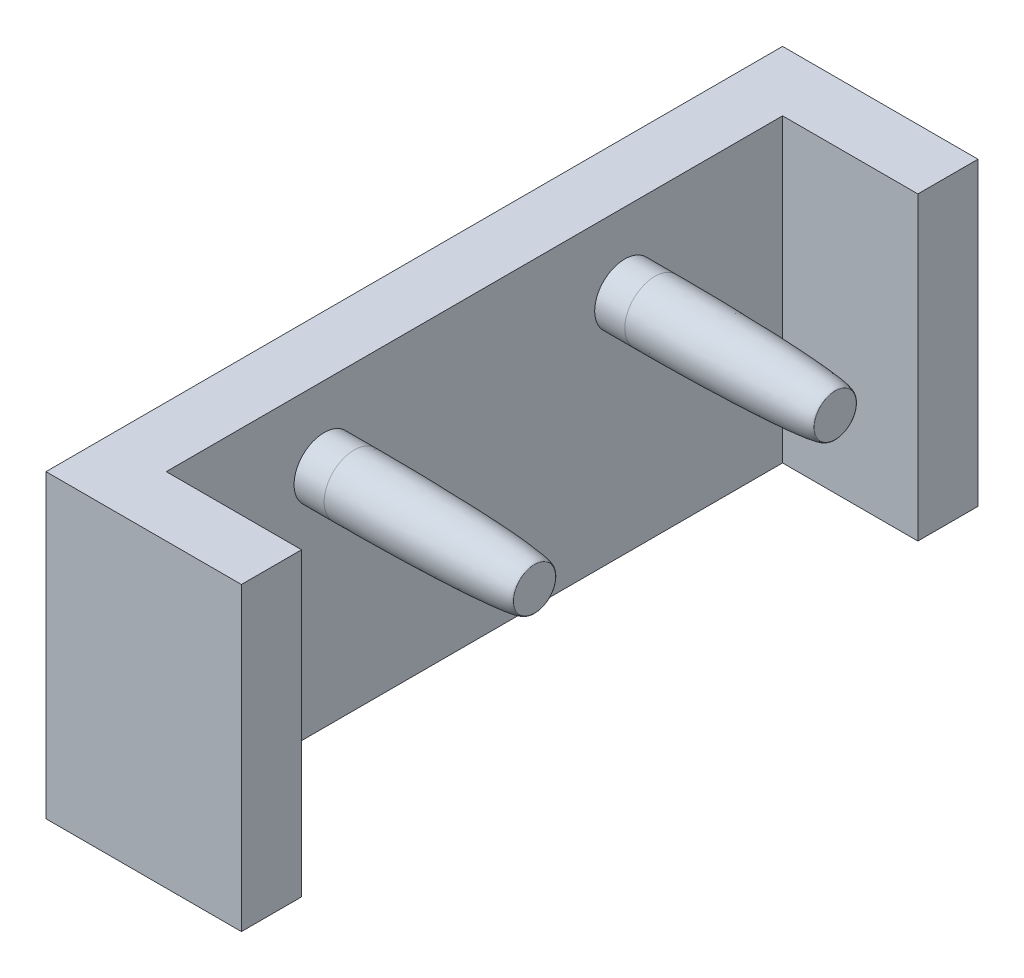
from build123d import *

# Parameters (mm, degrees)
SKETCH1_R             = 1
BOSS_EXTRUDE1_DEPTH   = 7
BOSS_EXTRUDE1_2_DEPTH = 7
SKETCH2_W             = 20.5
SKETCH2_H             = 10
BOSS_EXTRUDE2_DEPTH   = 2
SKETCH4_W             = 2
SKETCH4_H             = 10
BOSS_EXTRUDE3_DEPTH   = 6.5
FILLET1_SIZE          = 6
FILLET1_SIZE_2        = 0.3


with BuildPart() as part:
    # Sketch1 → Boss-Extrude1 (new body)
    with BuildSketch(Plane(origin=(0, 0, 0), x_dir=(0, 0, -1), z_dir=(1, 0, 0))):
        with Locations((-5, 0)):
            Circle(SKETCH1_R)
    extrude(amount=BOSS_EXTRUDE1_DEPTH)



with BuildPart() as body_2:
    # Sketch1 → Boss-Extrude1 2 (new body)
    with BuildSketch(Plane(origin=(0, 0, 0), x_dir=(0, 0, -1), z_dir=(1, 0, 0))):
        with Locations((5, 0)):
            Circle(SKETCH1_R)
    extrude(amount=BOSS_EXTRUDE1_2_DEPTH)


with BuildPart() as part_1:
    add(part.part)

    add(body_2.part)  # Boss-Extrude2 merges body 2
    # Sketch2 → Boss-Extrude2 (add)
    with BuildSketch(Plane.ZY):
        with Locations((0, -2.5)):
            Rectangle(SKETCH2_W, SKETCH2_H)
    extrude(amount=BOSS_EXTRUDE2_DEPTH)

    # Sketch4 → Boss-Extrude3 (add)
    with BuildSketch(Plane.ZY.offset(2)):
        with Locations((-11.25, -2.5)):
            Rectangle(SKETCH4_W, SKETCH4_H)
        with Locations((11.25, -2.5)):
            Rectangle(SKETCH4_W, SKETCH4_H)
    extrude(amount=-BOSS_EXTRUDE3_DEPTH)

    # Fillet1
    # an asymmetric fillet: 6, 0.3 mm, written as the material it takes off along each edge
    with BuildSketch(Plane(origin=(7, 0, -5), x_dir=(0, 0, -1), z_dir=(0, -1, 0))) as fillet1_piece_1:
        with BuildLine():
            Bezier((1, -FILLET1_SIZE), (1, 0), (1 - FILLET1_SIZE_2, 0), weights=[1, 0.707106781, 1])
            Line((1 - FILLET1_SIZE_2, 0), (1, 0))
            Line((1, 0), (1, -FILLET1_SIZE))
        make_face()
    revolve(axis=Axis((7, 0, -5), (1, 0, 0)), mode=Mode.SUBTRACT)
    with BuildSketch(Plane(origin=(7, 0, 5), x_dir=(0, 0, -1), z_dir=(0, -1, 0))) as fillet1_piece_2:
        with BuildLine():
            Bezier((1, -FILLET1_SIZE), (1, 0), (1 - FILLET1_SIZE_2, 0), weights=[1, 0.707106781, 1])
            Line((1 - FILLET1_SIZE_2, 0), (1, 0))
            Line((1, 0), (1, -FILLET1_SIZE))
        make_face()
    revolve(axis=Axis((7, 0, 5), (1, 0, 0)), mode=Mode.SUBTRACT)


solid = part_1.part
